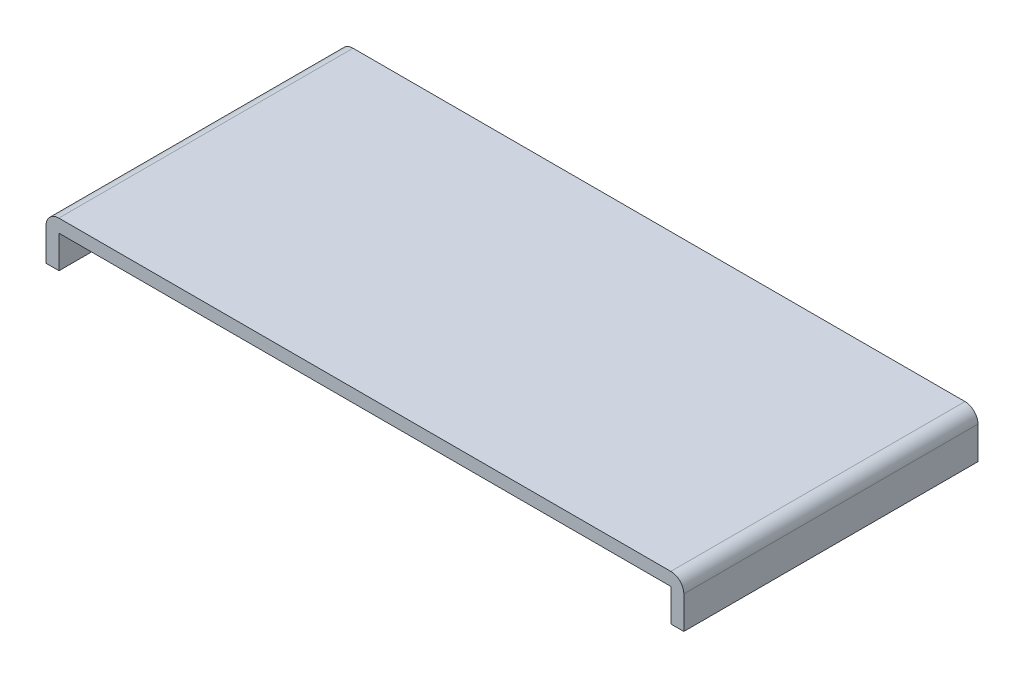
from build123d import *

# Parameters (mm, degrees)
SKETCH1_W               = 124.46
SKETCH1_H               = 57.404
BOSS_EXTRUDE1_DEPTH     = 2.54
CUT_EXTRUDE1_START      = -57.404
CUT_EXTRUDE1_DEPTH      = 57.404
CUT_EXTRUDE2_DEPTH      = 138.083778822
CUT_EXTRUDE2_DEPTH_BACK = 138.083778822
SKETCH5_W               = 2.54
SKETCH5_H               = 57.404
BOSS_EXTRUDE2_DEPTH     = 6.35
SKETCH7_W               = 2.54
SKETCH7_H               = 57.404
BOSS_EXTRUDE3_DEPTH     = 6.35


# Read off the part's stored shape, not the designer's step: Cut-Extrude1
with BuildPart() as part:
    # Sketch1 → Boss-Extrude1 (new body)
    with BuildSketch(Plane(origin=(0, 0, 0), x_dir=(1, 0, 0), z_dir=(0, 1, 0))):
        with Locations((62.23, 28.702)):
            Rectangle(SKETCH1_W, SKETCH1_H)
    extrude(amount=BOSS_EXTRUDE1_DEPTH)

    # Cut-Extrude1 outline → Cut-Extrude1 (cut)
    with BuildSketch(Plane.XY.offset(CUT_EXTRUDE1_START)):
        with BuildLine():
            Line((0, 2.54), (0, 0.035695157))
            ThreePointArc((0, 0.035695157), (0.738676689, 1.801323311), (2.504304843, 2.54))
            Line((2.504304843, 2.54), (0, 2.54))
        make_face()
    extrude(amount=CUT_EXTRUDE1_DEPTH, mode=Mode.SUBTRACT)

    # Sketch4 → Cut-Extrude2 (cut, two sides: drawn at the far end of the back side and taken through both)
    with BuildSketch(Plane.XY.offset(-CUT_EXTRUDE2_DEPTH_BACK)):
        with BuildLine():
            Line((-137.051831338, 2.54), (121.92, 2.54))
            ThreePointArc((121.92, 2.54), (123.716051224, 1.796051224), (124.46, 0))
            Line((124.46, 0), (124.46, -258.971831338))
            Line((124.46, -258.971831338), (490.701476151, 107.269644813))
            Line((490.701476151, 107.269644813), (229.189644813, 368.781476151))
            Line((229.189644813, 368.781476151), (-137.051831338, 2.54))
        make_face()
    extrude(amount=CUT_EXTRUDE2_DEPTH + CUT_EXTRUDE2_DEPTH_BACK, mode=Mode.SUBTRACT)

    # Sketch5 → Boss-Extrude2 (add)
    with BuildSketch(Plane.XZ):
        with Locations((1.27, -28.702)):
            Rectangle(SKETCH5_W, SKETCH5_H)
    extrude(amount=BOSS_EXTRUDE2_DEPTH)

    # Sketch7 → Boss-Extrude3 (add)
    with BuildSketch(Plane.XZ):
        with Locations((123.19, -28.702)):
            Rectangle(SKETCH7_W, SKETCH7_H)
    extrude(amount=BOSS_EXTRUDE3_DEPTH)


solid = part.part
